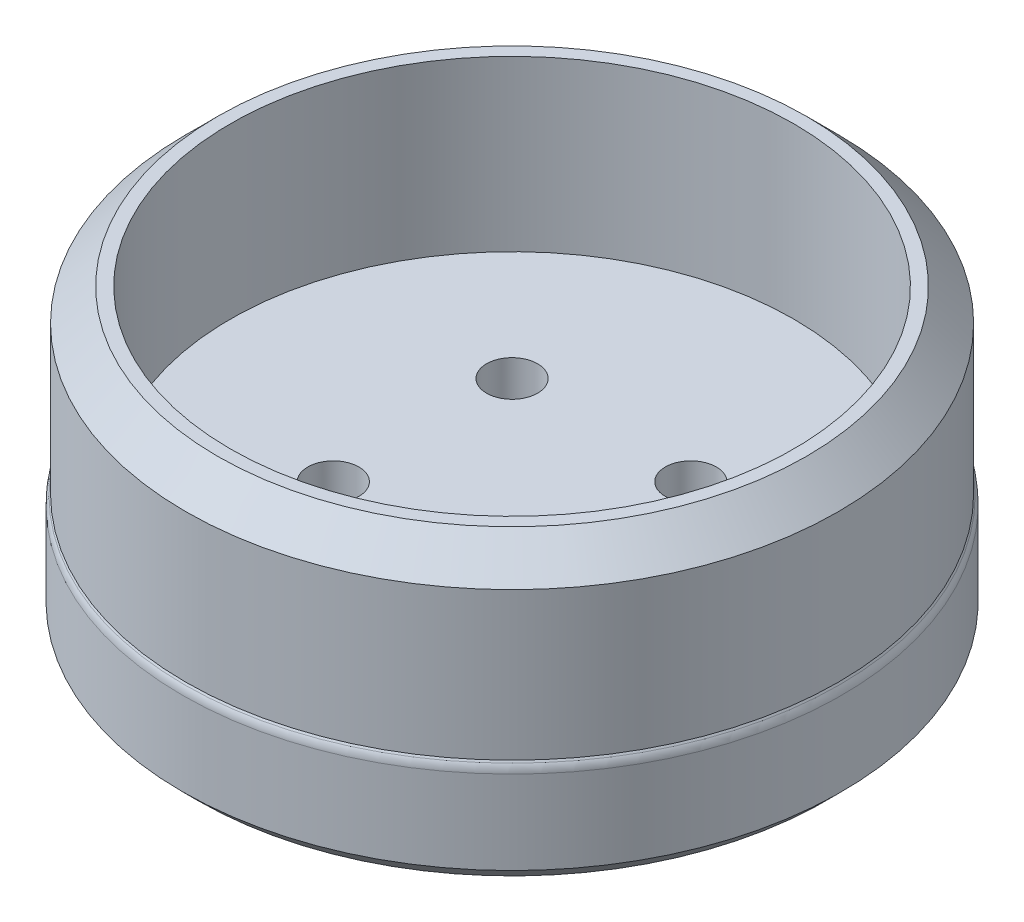
from build123d import *

# Parameters (mm, degrees)
BOSS_EXTRUDE1_DEPTH      = 6.5
BOSS_EXTRUDE1_DEPTH_BACK = 1
SKETCH1_R                = 20.65
SKETCH2_R                = 20.45
SKETCH2_R_2              = 17.65
BOSS_EXTRUDE2_DEPTH      = 10.6
SKETCH4_R                = 1.6
CUT_EXTRUDE1_DEPTH       = 13.5
SKETCH8_R                = 2.8
CUT_EXTRUDE2_DEPTH       = 2
CHAMFER1_SIZE            = 1
CHAMFER3_SIZE            = 1
CHAMFER3_SIZE_2          = 0.577350269
FILLET1_R                = 1
CHAMFER4_SIZE            = 2


# Some blends are built 0.0001 mm under size
with BuildPart() as part:
    # Sketch1 → Boss-Extrude1 (new, two sides: drawn at the far end of the back side and taken through both)
    with BuildSketch(Plane(origin=(0, 0, 0), x_dir=(1, 0, 0), z_dir=(0, 1, 0)).offset(-BOSS_EXTRUDE1_DEPTH_BACK)):
        with Locations(Location((0, 0, 0), (0, 0, 270))):
            Circle(SKETCH1_R)
    extrude(amount=BOSS_EXTRUDE1_DEPTH + BOSS_EXTRUDE1_DEPTH_BACK)

    # Sketch2 → Boss-Extrude2 (add)
    with BuildSketch(Plane(origin=(0, 6.5, 0), x_dir=(1, 0, 0), z_dir=(0, 1, 0))):
        with Locations(Location((0, 0, 0), (0, 0, 270))):
            Circle(SKETCH2_R)
        with Locations(Location((0, 0, 0), (0, 0, 270))):
            Circle(SKETCH2_R_2, mode=Mode.SUBTRACT)
    extrude(amount=BOSS_EXTRUDE2_DEPTH)

    # Sketch4 → Cut-Extrude1 (cut)
    with BuildSketch(Plane.XZ.offset(1)):
        with Locations(Location((-5.6, 5.6, 0), (0, 0, 270))):
            Circle(SKETCH4_R)
        with Locations(Location((5.6, 5.6, 0), (0, 0, 270))):
            Circle(SKETCH4_R)
        with Locations(Location((5.6, -5.6, 0), (0, 0, 270))):
            Circle(SKETCH4_R)
        with Locations(Location((-5.6, -5.6, 0), (0, 0, 270))):
            Circle(SKETCH4_R)
    extrude(amount=-CUT_EXTRUDE1_DEPTH, mode=Mode.SUBTRACT)

    # Sketch8 → Cut-Extrude2 (cut)
    with BuildSketch(Plane.XZ.offset(1)):
        with Locations(Location((5.6, -5.6, 0), (0, 0, 270))):
            Circle(SKETCH8_R)
        with Locations(Location((-5.6, -5.6, 0), (0, 0, 270))):
            Circle(SKETCH8_R)
        with Locations(Location((-5.6, 5.6, 0), (0, 0, 270))):
            Circle(SKETCH8_R)
        with Locations(Location((5.6, 5.6, 0), (0, 0, 270))):
            Circle(SKETCH8_R)
    extrude(amount=-CUT_EXTRUDE2_DEPTH, mode=Mode.SUBTRACT)

    # Chamfer1
    chamfer1_edges = [part.edges().sort_by_distance(p)[0] for p in [
        (0, -1, -20.65),
    ]]
    chamfer(chamfer1_edges, length=CHAMFER1_SIZE - 0.0001)  # a hair under: the kernel refuses the full size

    # Chamfer3
    # the kernel refuses this chamfer: 1, 0.577350269 mm, written as the material it takes off along each edge
    with BuildSketch(Plane(origin=(0, 6.5, 0), x_dir=(0, 0, 1), z_dir=(-1, 0, 0))) as chamfer3_piece_1_section:
        Polygon((20.65, -CHAMFER3_SIZE), (20.65 - CHAMFER3_SIZE_2, 0), (20.65, 0), align=None)
    chamfer3_piece_1 = revolve(axis=Axis((0, 6.5, 0), (0, 1, 0)), mode=Mode.PRIVATE)
    chamfer3_piece_1 = chamfer3_piece_1 - Plane(origin=(0, 5.670486655, 0), x_dir=(0, 0, 1), z_dir=(0, -1, 0)) * Cylinder(20.45, 83, mode=Mode.PRIVATE)
    add(chamfer3_piece_1, mode=Mode.SUBTRACT)

    # Fillet1
    fillet1_edges = [part.edges().sort_by_distance(p)[0] for p in [
        (0, 5.5, -20.65),
    ]]
    fillet(fillet1_edges, radius=FILLET1_R)

    # Chamfer4
    chamfer4_edges = [part.edges().sort_by_distance(p)[0] for p in [
        (0, 17.1, -20.45),
    ]]
    chamfer(chamfer4_edges, length=CHAMFER4_SIZE)


solid = part.part
